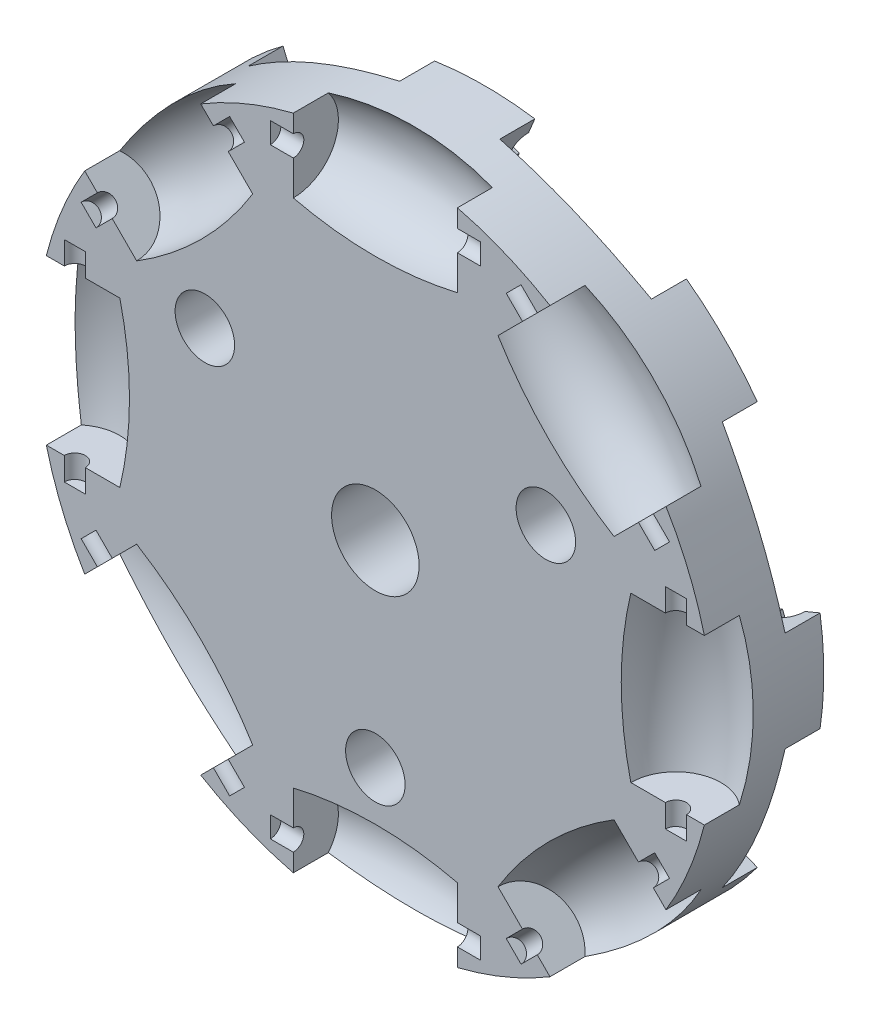
from build123d import *

# Parameters (mm, degrees)
SKETCH1_R           = 24.60625
BOSS_EXTRUDE1_DEPTH = 3.96875
SKETCH6_R           = 0.762
CUT_EXTRUDE2_DEPTH  = 7.62
SKETCH10_R          = 0.889
CUT_EXTRUDE3_DEPTH  = 7.9375
CIRPATTERN1_COUNT   = 8
SKETCH16_R          = 2.159
CUT_EXTRUDE7_DEPTH  = 36.69228202
SKETCH17_R          = 3.175
CUT_EXTRUDE8_DEPTH  = 36.69228202


with BuildPart() as part:
    # Sketch1 → Boss-Extrude1 (new, symmetric)
    with BuildSketch(Plane.XY):
        Circle(SKETCH1_R)
    extrude(amount=BOSS_EXTRUDE1_DEPTH, both=True)

    # Sketch5 → Cut-Revolve5 (revolve, cut)
    with BuildSketch(Plane.XY.offset(3.96875)):
        with BuildLine():
            Line((-5.953125, 25.084263269), (-5.953125, 21.81225))
            Line((-5.953125, 21.81225), (5.953125, 21.81225))
            Line((5.953125, 21.81225), (5.953125, 25.084263269))
            ThreePointArc((5.953125, 25.084263269), (0, 25.781), (-5.953125, 25.084263269))
        make_face()
    cut_revolve5 = revolve(axis=Axis((-5.953125, 21.81225, 3.96875), (1, 0, 0)), mode=Mode.SUBTRACT)

    # Sketch8 → Cut-Revolve6 (revolve, cut)
    with BuildSketch(Plane.XY.offset(-3.96875)):
        with BuildLine():
            Line((4.099361624, 25.45299973), (2.847216356, 22.430053641))
            Line((2.847216356, 22.430053641), (13.84715704, 17.873729025))
            Line((13.84715704, 17.873729025), (15.099302308, 20.896675114))
            ThreePointArc((15.099302308, 20.896675114), (9.86596157, 23.818538228), (4.099361624, 25.45299973))
        make_face()
    cut_revolve6 = revolve(axis=Axis((2.847216356, 22.430053641, -3.96875), (-0.9238795325112865, 0.3826834323650905, 0)), mode=Mode.SUBTRACT)

    # Sketch6 → Cut-Extrude2 (cut, symmetric)
    with BuildSketch(Plane(origin=(0, 0, 0), x_dir=(0, 0, -1), z_dir=(1, 0, 0))):
        with Locations((-3.96875, 21.81225)):
            Circle(SKETCH6_R)
    cut_extrude2 = extrude(amount=CUT_EXTRUDE2_DEPTH, both=True, mode=Mode.SUBTRACT)

    # Sketch10 → Cut-Extrude3 (cut, symmetric)
    with BuildSketch(Plane(origin=(0, 0, 0), x_dir=(0, 0, -1), z_dir=(0.9238795325112866, -0.38268343236509017, 0))):
        with Locations((3.96875, 21.81225)):
            Circle(SKETCH10_R)
    cut_extrude3 = extrude(amount=CUT_EXTRUDE3_DEPTH, both=True, mode=Mode.SUBTRACT)

    # CirPattern1: Cut-Revolve5, Cut-Revolve6, Cut-Extrude2, Cut-Extrude3 ×8 about axis
    cirpattern1_axis = Axis((0, 0, 3.96875), (0, 0, -1))
    add([cut_revolve5.rotate(cirpattern1_axis, i * 360 / CIRPATTERN1_COUNT) for i in range(1, CIRPATTERN1_COUNT)], mode=Mode.SUBTRACT)
    add([cut_revolve6.rotate(cirpattern1_axis, i * 360 / CIRPATTERN1_COUNT) for i in range(1, CIRPATTERN1_COUNT)], mode=Mode.SUBTRACT)
    add([cut_extrude2.rotate(cirpattern1_axis, i * 360 / CIRPATTERN1_COUNT) for i in range(1, CIRPATTERN1_COUNT)], mode=Mode.SUBTRACT)
    add([cut_extrude3.rotate(cirpattern1_axis, i * 360 / CIRPATTERN1_COUNT) for i in range(1, CIRPATTERN1_COUNT)], mode=Mode.SUBTRACT)

    # Sketch16 → Cut-Extrude7 (cut, through all)
    with BuildSketch(Plane.XY.offset(3.96875)):
        with Locations((0, -14.2875)):
            Circle(SKETCH16_R)
        with Locations((-12.373337957, 7.14375)):
            Circle(SKETCH16_R)
        with Locations((12.373337957, 7.14375)):
            Circle(SKETCH16_R)
    extrude(amount=-CUT_EXTRUDE7_DEPTH, mode=Mode.SUBTRACT)

    # Sketch17 → Cut-Extrude8 (cut, through all)
    with BuildSketch(Plane.XY.offset(3.96875)):
        Circle(SKETCH17_R)
    extrude(amount=-CUT_EXTRUDE8_DEPTH, mode=Mode.SUBTRACT)


solid = part.part
